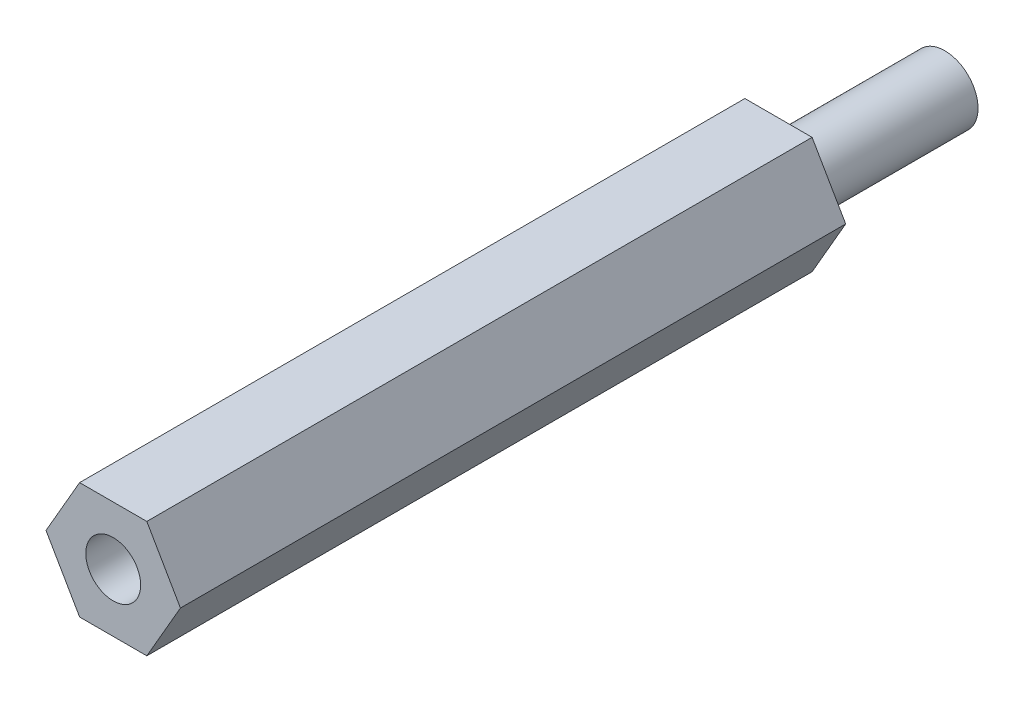
from build123d import *

# Parameters (mm, degrees)
EXTRUDE_1_DEPTH = 40
SKETCH_4_R      = 2
EXTRUDE_2_DEPTH = 10
M4X0_7_1_D      = 3.3
M4X0_7_1_DEPTH  = 10.1
M4X0_7_1_TIP    = 0.991420021


with BuildPart() as part:
    # 草圖1 → 填料-伸長1 (new body)
    with BuildSketch(Plane.XY):
        Polygon((-2.020725942, 3.5), (-4.041451884, 0), (-2.020725942, -3.5), (2.020725942, -3.5), (4.041451884, 0), (2.020725942, 3.5), align=None)
    extrude(amount=EXTRUDE_1_DEPTH)

    # 草圖4 → 填料-伸長2 (add)
    with BuildSketch(Plane(origin=(0, 0, 0), x_dir=(-1, 0, 0), z_dir=(0, 0, -1))):
        Circle(SKETCH_4_R)
    extrude(amount=EXTRUDE_2_DEPTH)

    # M4x0.7 螺紋孔1
    with Locations(Plane.XY.offset(40)):
        with Locations((0, 0)):
            Hole(M4X0_7_1_D / 2, depth=M4X0_7_1_DEPTH)
            with Locations((0, 0, -(M4X0_7_1_DEPTH + M4X0_7_1_TIP / 2))):  # 118° drill point
                Cone(0, M4X0_7_1_D / 2, M4X0_7_1_TIP, mode=Mode.SUBTRACT)


solid = part.part
